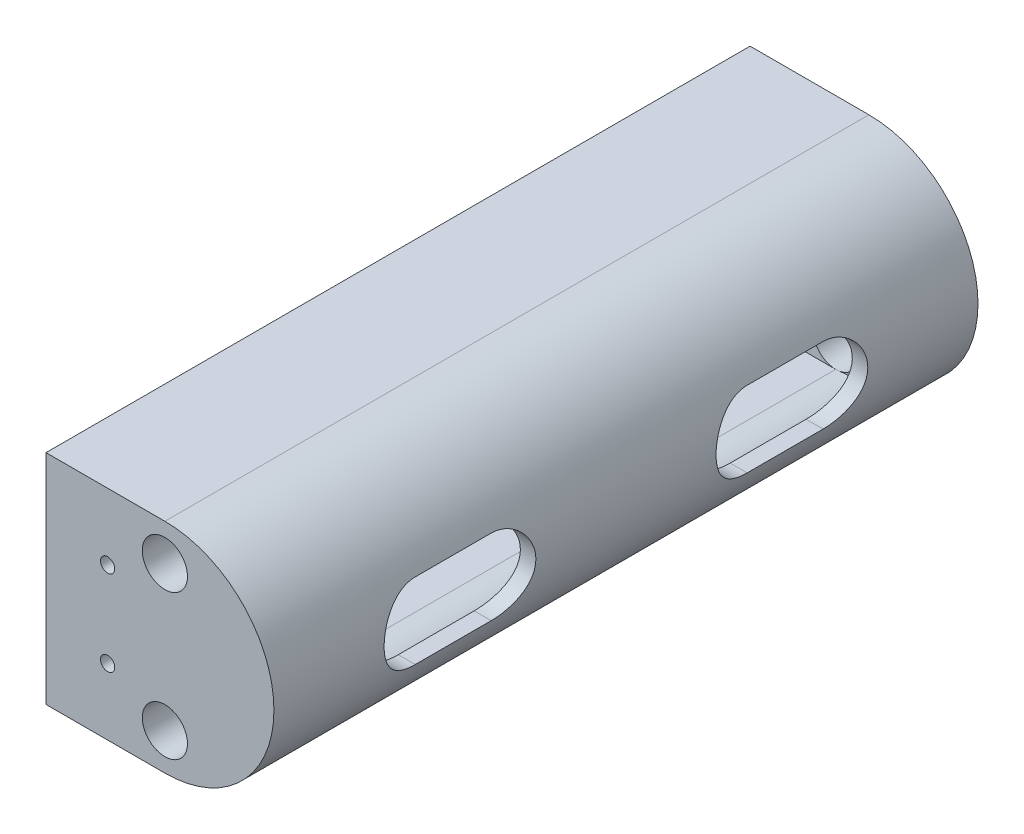
from build123d import *

# Parameters (mm, degrees)
CROQUIS1_R              = 4.7625
SALIENTE_EXTRUIR3_DEPTH = 7
SALIENTE_EXTRUIR4_DEPTH = 134.48
CROQUIS4_R              = 4.7625
SALIENTE_EXTRUIR5_DEPTH = 7
CORTAR_EXTRUIR1_DEPTH   = 158.75308333
CROQUIS6_R              = 4.765
CORTAR_EXTRUIR2_DEPTH   = 190
CROQUIS8_R              = 1.5
CORTAR_EXTRUIR3_DEPTH   = 154


with BuildPart() as part:
    # Croquis1 → Saliente-Extruir3 (new body)
    with BuildSketch(Plane.XY):
        with BuildLine():
            Line((-25.07, -23), (0, -23))
            ThreePointArc((0, -23), (23, 0), (0, 23))
            Line((0, 23), (-25.07, 23))
            Line((-25.07, 23), (-25.07, -23))
        make_face()
        with Locations((0, -15.2375)):
            Circle(CROQUIS1_R, mode=Mode.SUBTRACT)
    extrude(amount=SALIENTE_EXTRUIR3_DEPTH)

    # Croquis3 → Saliente-Extruir4 (add)
    with BuildSketch(Plane.XY.offset(7)):
        with BuildLine():
            Line((0, 23), (-25.07, 23))
            Line((-25.07, 23), (-25.07, 20))
            Line((-25.07, 20), (1.496213225, 20.399741169))
            ThreePointArc((1.496213225, 20.399741169), (19.71970984, -0.502746878), (0, -20))
            Line((0, -20), (-25.07, -20))
            Line((-25.07, -20), (-25.07, -23))
            Line((-25.07, -23), (0, -23))
            ThreePointArc((0, -23), (23, 0), (0, 23))
        make_face()
    extrude(amount=SALIENTE_EXTRUIR4_DEPTH)

    # Croquis4 → Saliente-Extruir5 (add)
    with BuildSketch(Plane.XY.offset(141.48)):
        with BuildLine():
            Line((-25.07, 23), (-25.07, -23))
            Line((-25.07, -23), (0, -23))
            ThreePointArc((0, -23), (23, 0), (0, 23))
            Line((0, 23), (-25.07, 23))
        make_face()
        with Locations((0, -15.2375)):
            Circle(CROQUIS4_R, mode=Mode.SUBTRACT)
    extrude(amount=SALIENTE_EXTRUIR5_DEPTH)

    # Croquis5 → Cortar-Extruir1 (cut, through all)
    with BuildSketch(Plane.ZY.offset(25.07)):
        with BuildLine():
            Line((31.24, 8), (47.24, 8))
            ThreePointArc((47.24, 8), (55.24, 0), (47.24, -8))
            Line((47.24, -8), (31.24, -8))
            ThreePointArc((31.24, -8), (23.24, 0), (31.24, 8))
        make_face()
        with BuildLine():
            Line((117.24, 8), (101.24, 8))
            ThreePointArc((101.24, 8), (93.24, 0), (101.24, -8))
            Line((101.24, -8), (117.24, -8))
            ThreePointArc((117.24, -8), (125.24, 0), (117.24, 8))
        make_face()
    extrude(amount=-CORTAR_EXTRUIR1_DEPTH, mode=Mode.SUBTRACT)

    # Croquis6 → Cortar-Extruir2 (cut)
    with BuildSketch(Plane.XY.offset(148.48)):
        with Locations((0, 15.2925)):
            Circle(CROQUIS6_R)
    extrude(amount=-CORTAR_EXTRUIR2_DEPTH, mode=Mode.SUBTRACT)

    # Croquis8 → Cortar-Extruir3 (cut)
    with BuildSketch(Plane.XY.offset(148.48)):
        with Locations((-12.07, 9)):
            Circle(CROQUIS8_R)
        with Locations((-12.07, -9)):
            Circle(CROQUIS8_R)
    extrude(amount=-CORTAR_EXTRUIR3_DEPTH, mode=Mode.SUBTRACT)


solid = part.part
